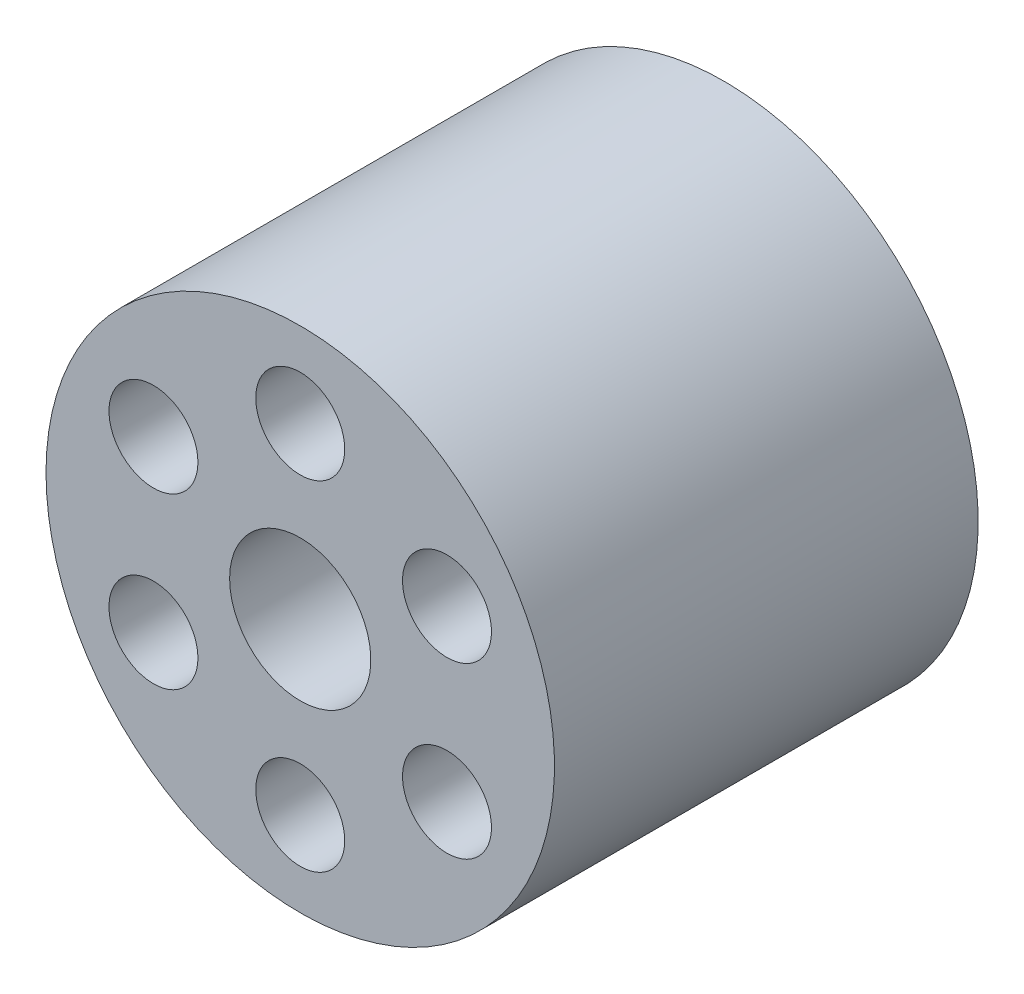
from build123d import *

# Parameters (mm, degrees)
SKETCH1_R             = 11.43
SKETCH1_R_2           = 3.175
BOSS_EXTRUDE1_DEPTH   = 19.05
F_4_0MM_DOWEL_HOLE2_D = 4
CIRPATTERN1_COUNT     = 6


with BuildPart() as part:
    # Sketch1 → Boss-Extrude1 (new body)
    with BuildSketch(Plane.XY):
        Circle(SKETCH1_R)
        Circle(SKETCH1_R_2, mode=Mode.SUBTRACT)
    extrude(amount=BOSS_EXTRUDE1_DEPTH)

    # Ø4.0mm Dowel Hole2 (through all)
    with Locations(Plane.XY.offset(19.05)):
        with Locations((0, 7.62)):
            f_4_0mm_dowel_hole2 = Hole(F_4_0MM_DOWEL_HOLE2_D / 2)

    # CirPattern1: Ø4.0mm Dowel Hole2 ×6 about axis
    cirpattern1_axis = Axis((0, 0, 19.05), (0, 0, -1))
    for i in range(1, CIRPATTERN1_COUNT):
        add(f_4_0mm_dowel_hole2.rotate(cirpattern1_axis, i * 360 / CIRPATTERN1_COUNT), mode=Mode.SUBTRACT)


solid = part.part
